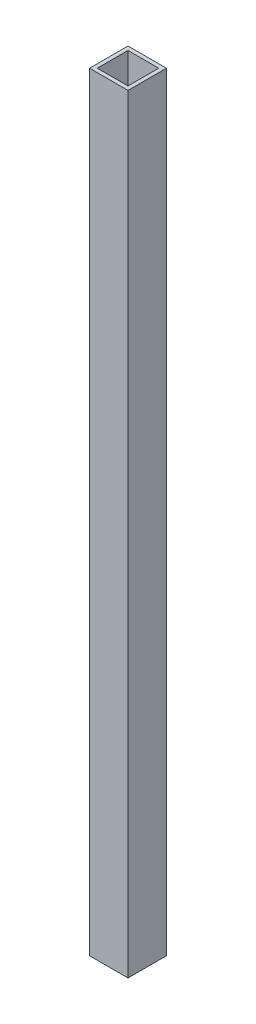
from build123d import *

# Parameters (mm, degrees)
SKETCH1_W           = 15
SKETCH1_H           = 15
SKETCH1_W_2         = 12
SKETCH1_H_2         = 12
EXTRUDE_THIN1_DEPTH = 300


with BuildPart() as part:
    # Sketch1 → Extrude-Thin1 (new body)
    with BuildSketch(Plane(origin=(0, 0, 0), x_dir=(1, 0, 0), z_dir=(0, 1, 0))):
        with Locations((7.5, 7.5)):
            Rectangle(SKETCH1_W, SKETCH1_H)
        with Locations((7.5, 7.5)):
            Rectangle(SKETCH1_W_2, SKETCH1_H_2, mode=Mode.SUBTRACT)
    extrude(amount=EXTRUDE_THIN1_DEPTH)


solid = part.part
